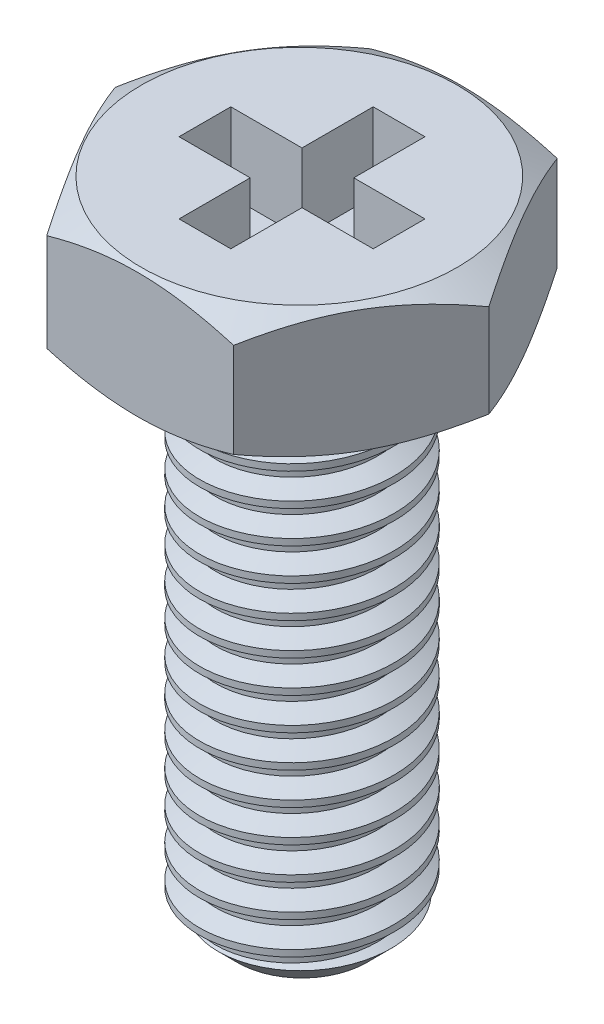
from build123d import *

# Parameters (mm, degrees)
EXTRUDE_2_DEPTH     = 2
SKETCH_5_R          = 1.5
EXTRUDE_3_DEPTH     = 8
CHAMFER_1_SIZE      = 0.5
SWEEP_1_PITCH       = 0.5
SWEEP_1_TO          = 8
CUT_EXTRUDE_1_DEPTH = 1.2


with BuildPart() as part:
    # 草圖3 → 填料-伸長2 (new body)
    with BuildSketch(Plane(origin=(0, 0, 0), x_dir=(1, 0, 0), z_dir=(0, 1, 0))):
        Polygon((1.443375673, 2.5), (-1.443375673, 2.5), (-2.886751346, 0), (-1.443375673, -2.5), (1.443375673, -2.5), (2.886751346, 0), align=None)
    extrude(amount=EXTRUDE_2_DEPTH)

    # 草圖4 → 除料-旋轉2 (revolve, cut)
    with BuildSketch(Plane.XY, mode=Mode.PRIVATE) as cut_revolve_2_sk:
        Polygon((2.886751346, 0), (2.886751346, 0.281788718), (2.39867897, 0), align=None)
        Polygon((2.39867897, 2), (2.886751346, 2), (2.886751346, 1.718211282), align=None)
    revolve(cut_revolve_2_sk.sketch.rotate(Axis((-0.041843955, 1, 0), (0, 1, 0)), 90), axis=Axis((-0.041843955, 1, 0), (0, 1, 0)), mode=Mode.SUBTRACT)

    # 草圖5 → 填料-伸長3 (add)
    with BuildSketch(Plane.XZ):
        with Locations(Location((0, 0, 0), (0, 0, 270))):
            Circle(SKETCH_5_R)
    extrude(amount=EXTRUDE_3_DEPTH)

    # 導角1
    chamfer_1_edges = [part.edges().sort_by_distance(p)[0] for p in [
        (0, -8, 1.5),
    ]]
    chamfer(chamfer_1_edges, length=CHAMFER_1_SIZE)

    # 除料-掃出1: arcs per turn and ends read off the stored shape
    # 除料-掃出1: the profile of 草圖8 profile screwed along a right-hand helix through 16.666667 turns, 6 arcs to a turn; built about Z, then put on its axis
    sweep_1_z = Axis((0, 0, 0), (0, 0, 1))
    sweep_1_corners = [(1.5003, 0, -0.200173205), (1.5003, 0, 0.200173205), (1.25, 0, 0.055662433), (1.25, 0, -0.055662433)]
    with BuildLine(mode=Mode.PRIVATE) as sweep_1_profile:
        Line(sweep_1_corners[0], sweep_1_corners[1])
        Line(sweep_1_corners[1], sweep_1_corners[2])
        Line(sweep_1_corners[2], sweep_1_corners[3])
        Line(sweep_1_corners[3], sweep_1_corners[0])
    sweep_1_cap = Face(sweep_1_profile.wire())
    sweep_1_turn_angles = [0, 30, 60, 90, 120, 150, 180, 210, 240, 270, 300, 330, 360]
    sweep_1_turn_weights = [1, 0.8660254037844387, 1, 0.8660254037844387, 1, 0.8660254037844387, 1, 0.8660254037844387, 1, 0.8660254037844387, 1, 0.8660254037844387, 1]
    sweep_1_turn_rails = [Edge.make_bspline([Vector(p[0], p[1], 0).rotate(sweep_1_z, sweep_1_turn_angles[k]) / sweep_1_turn_weights[k] + Vector(0, 0, p[2] + SWEEP_1_PITCH * sweep_1_turn_angles[k] / 360) for k in range(13)], [0, 0, 0, 1, 1, 2, 2, 3, 3, 4, 4, 5, 5, 6, 6, 6], 2, sweep_1_turn_weights) for p in sweep_1_corners]
    sweep_1_turn_sides = [Face.make_surface_from_curves(sweep_1_turn_rails[p[0]], sweep_1_turn_rails[p[1]]) for p in [(0, 1), (1, 2), (2, 3), (3, 0)]]
    sweep_1_last_angles = [5760, 5790, 5820, 5850, 5880, 5910, 5940, 5970, 6000]
    sweep_1_last_weights = [1, 0.8660254037844387, 1, 0.8660254037844387, 1, 0.8660254037844387, 1, 0.8660254037844387, 1]
    sweep_1_last_rails = [Edge.make_bspline([Vector(p[0], p[1], 0).rotate(sweep_1_z, sweep_1_last_angles[k]) / sweep_1_last_weights[k] + Vector(0, 0, p[2] + SWEEP_1_PITCH * sweep_1_last_angles[k] / 360) for k in range(9)], [0, 0, 0, 1, 1, 2, 2, 3, 3, 4, 4, 4], 2, sweep_1_last_weights) for p in sweep_1_corners]
    sweep_1_last_sides = [Face.make_surface_from_curves(sweep_1_last_rails[p[0]], sweep_1_last_rails[p[1]]) for p in [(0, 1), (1, 2), (2, 3), (3, 0)]]
    sweep_1 = Plane(origin=(0, -8, 0), x_dir=(1, 0, 0), z_dir=(0, 1, 0)) * split(Solid(Shell([*[p.moved(Location((0, 0, SWEEP_1_PITCH * i))) for i in range(16) for p in sweep_1_turn_sides], *sweep_1_last_sides, sweep_1_cap, sweep_1_cap.rotate(sweep_1_z, 6000).moved(Location((0, 0, SWEEP_1_PITCH * 6000 / 360)))])), bisect_by=Plane.XY.offset(SWEEP_1_TO), keep=Keep.BOTTOM, mode=Mode.PRIVATE)
    add(sweep_1, mode=Mode.SUBTRACT)

    # 草圖9 → 除料-伸長1 (cut)
    with BuildSketch(Plane(origin=(0, 2, 0), x_dir=(1, 0, 0), z_dir=(0, 1, 0))):
        Polygon((-0.4, 0.4), (-1.5, 0.4), (-1.5, -0.4), (-0.4, -0.4), (-0.4, -1.5), (0.4, -1.5), (0.4, -0.4), (1.5, -0.4), (1.5, 0.4), (0.4, 0.4), (0.4, 1.5), (-0.4, 1.5), align=None)
    extrude(amount=-CUT_EXTRUDE_1_DEPTH, mode=Mode.SUBTRACT)


solid = part.part
